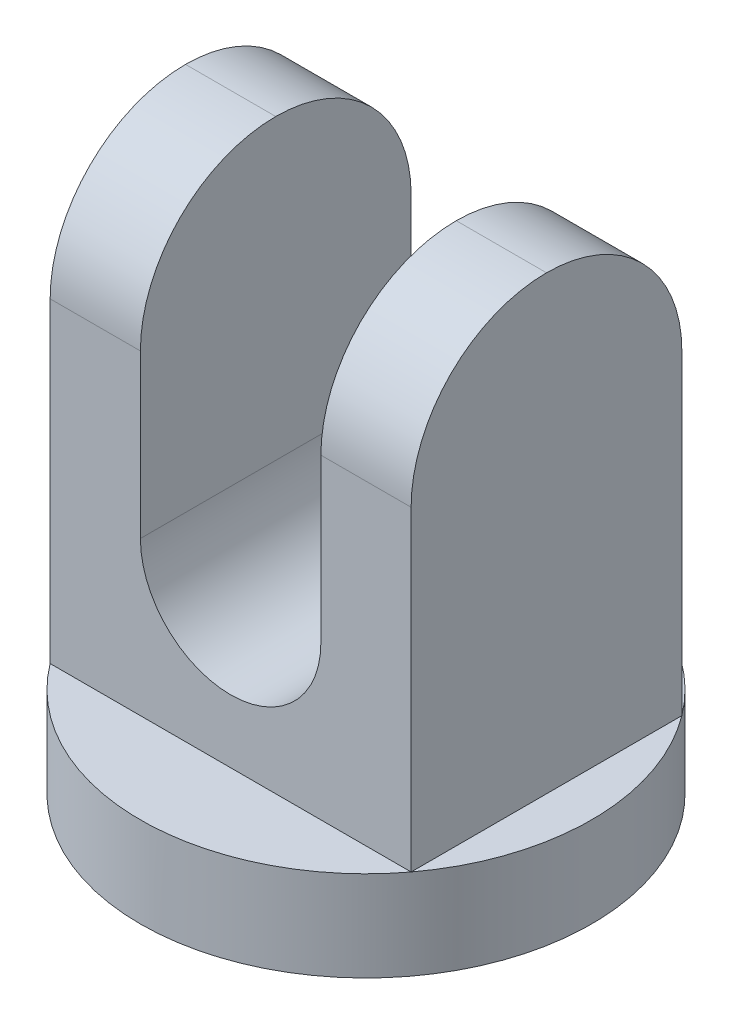
from build123d import *

# Parameters (mm, degrees)
SKETCH_1_R          = 250
EXTRUDE_1_DEPTH     = 100
SKETCH_2_W          = 400
SKETCH_2_H          = 300
EXTRUDE_2_DEPTH     = 500
FILLET_1_R          = 150
FILLET_2_R          = 150
CUT_EXTRUDE_1_DEPTH = 250
SKETCH_4_R          = 100
CUT_EXTRUDE_2_DEPTH = 250


with BuildPart() as part:
    # 草图1 → 凸台-拉伸1 (new body)
    with BuildSketch(Plane(origin=(0, 0, 0), x_dir=(1, 0, 0), z_dir=(0, 1, 0))):
        with Locations(Location((0, 0, 0), (0, 0, 270))):
            Circle(SKETCH_1_R)
    extrude(amount=EXTRUDE_1_DEPTH)

    # 草图2 → 凸台-拉伸2 (add)
    with BuildSketch(Plane(origin=(0, 100, 0), x_dir=(1, 0, 0), z_dir=(0, 1, 0))):
        Rectangle(SKETCH_2_W, SKETCH_2_H)
    extrude(amount=EXTRUDE_2_DEPTH)

    # 圆角1
    fillet_1_edges = [part.edges().sort_by_distance(p)[0] for p in [
        (0, 600, 150),
    ]]
    fillet(fillet_1_edges, radius=FILLET_1_R)

    # 圆角2
    fillet_2_edges = [part.edges().sort_by_distance(p)[0] for p in [
        (0, 600, -150),
    ]]
    fillet(fillet_2_edges, radius=FILLET_2_R - 0.0001)  # a hair under: the kernel refuses the full size

    # 草图3 → 切除-拉伸1 (cut, symmetric)
    with BuildSketch(Plane.XY):
        Polygon((0, 600), (100, 600), (100, 270), (0, 270), (-100, 270), (-100, 600), align=None)
    extrude(amount=CUT_EXTRUDE_1_DEPTH, both=True, mode=Mode.SUBTRACT)

    # 草图4 → 切除-拉伸2 (cut, symmetric)
    with BuildSketch(Plane.XY):
        with Locations((0, 270)):
            Circle(SKETCH_4_R)
    extrude(amount=CUT_EXTRUDE_2_DEPTH, both=True, mode=Mode.SUBTRACT)


solid = part.part
